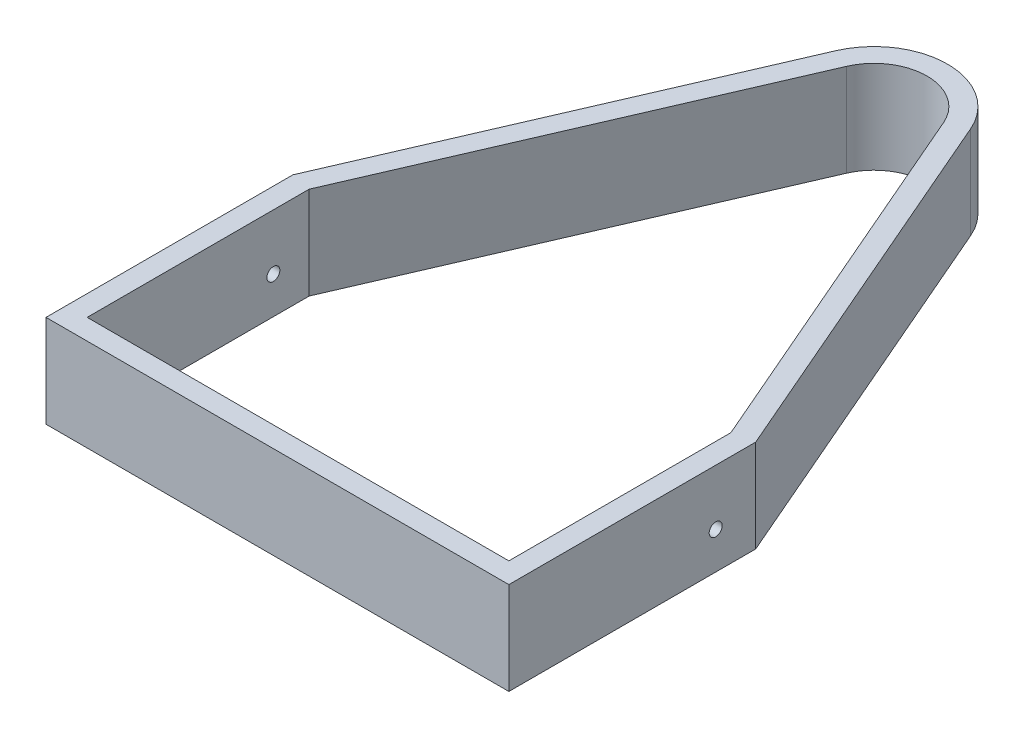
from build123d import *

# Parameters (mm, degrees)
BOSS_EXTRUDE1_DEPTH = 28.575
CUT_EXTRUDE1_REACH  = 287.779
CUT_EXTRUDE1_START  = -65.0875
SKETCH2_R           = 2
CUT_EXTRUDE3_REACH  = 287.779
CUT_EXTRUDE3_START  = 65.0875
SKETCH2_2_R         = 2


with BuildPart() as part:
    # Sketch1 → Boss-Extrude1 (new body)
    with BuildSketch(Plane(origin=(0, 0, 0), x_dir=(1, 0, 0), z_dir=(0, 1, 0))):
        with BuildLine():
            Line((-71.4375, 0), (71.4375, 0))
            Line((71.4375, 0), (71.4375, 76.2))
            Line((71.4375, 76.2), (20.828751655, 193.16244062))
            ThreePointArc((20.828751655, 193.16244062), (0, 206.844954977), (-20.828751655, 193.16244062))
            Line((-20.828751655, 193.16244062), (-71.4375, 76.2))
            Line((-71.4375, 76.2), (-71.4375, 0))
        make_face()
        with BuildLine():
            Line((-65.0875, 6.35), (-65.0875, 74.885107442))
            Line((-65.0875, 74.885107442), (-15.000911364, 190.640778956))
            ThreePointArc((-15.000911364, 190.640778956), (0, 200.494954977), (15.000911364, 190.640778956))
            Line((15.000911364, 190.640778956), (65.0875, 74.885107442))
            Line((65.0875, 74.885107442), (65.0875, 6.35))
            Line((65.0875, 6.35), (-65.0875, 6.35))
        make_face(mode=Mode.SUBTRACT)
    extrude(amount=BOSS_EXTRUDE1_DEPTH)

    # Sketch2 → Cut-Extrude1 (cut, up to next)
    with BuildSketch(Plane(origin=(0, 0, 0), x_dir=(0, 0, -1), z_dir=(1, 0, 0)).offset(CUT_EXTRUDE1_START), mode=Mode.PRIVATE) as cut_extrude1_sk1:
        with Locations((63.836107442, 11.43)):
            Circle(SKETCH2_R)
    cut_extrude1_tool1 = extrude(cut_extrude1_sk1.sketch, amount=-CUT_EXTRUDE1_REACH, mode=Mode.PRIVATE) & part.part
    add(cut_extrude1_tool1.solids().sort_by_distance((-65.0875, 11.43, -63.836107))[0], mode=Mode.SUBTRACT)

    # Sketch2<2> → Cut-Extrude3 (cut, up to next)
    with BuildSketch(Plane(origin=(0, 0, 0), x_dir=(0, 0, -1), z_dir=(1, 0, 0)).offset(CUT_EXTRUDE3_START), mode=Mode.PRIVATE) as cut_extrude3_sk1:
        with Locations((63.836107442, 11.43)):
            Circle(SKETCH2_2_R)
    cut_extrude3_tool1 = extrude(cut_extrude3_sk1.sketch, amount=CUT_EXTRUDE3_REACH, mode=Mode.PRIVATE) & part.part
    add(cut_extrude3_tool1.solids().sort_by_distance((65.0875, 11.43, -63.836107))[0], mode=Mode.SUBTRACT)


solid = part.part
